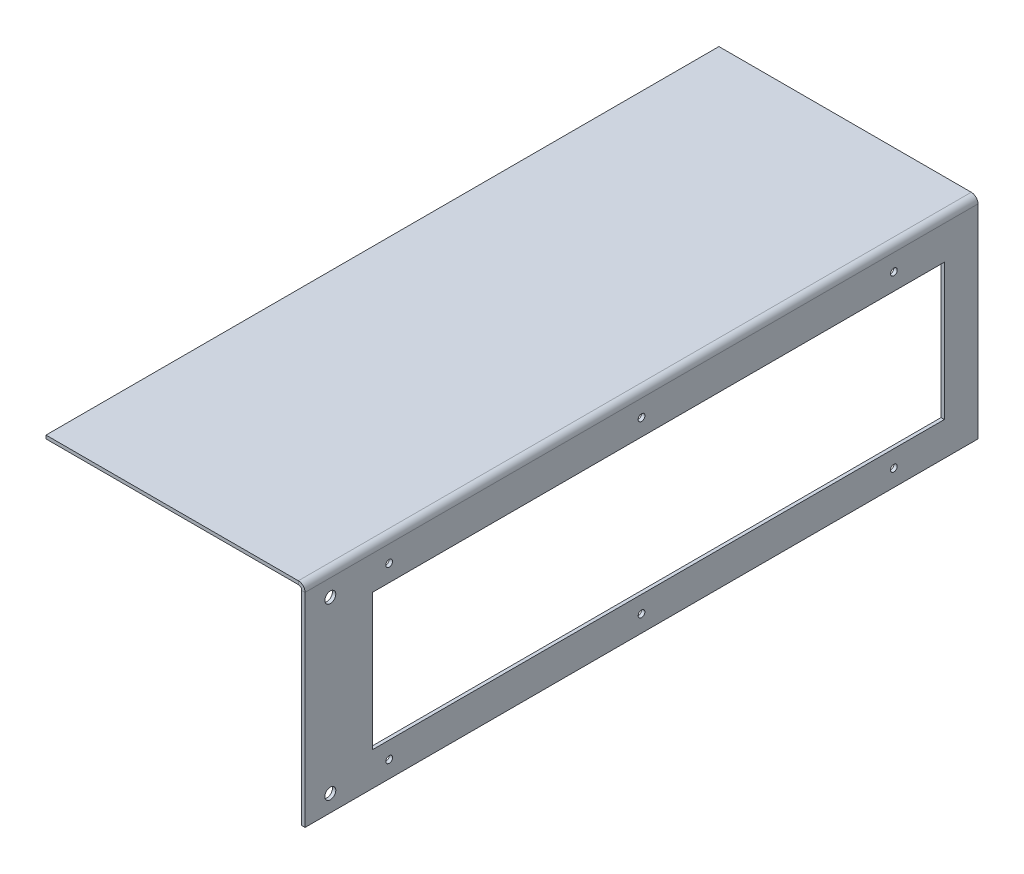
from build123d import *

# Parameters (mm, degrees)
BOSS_EXTRUDE1_DEPTH  = 400
CUT_EXTRUDE1_REACH   = 448.476
SKETCH2_W            = 340
SKETCH2_H            = 81
CUT_EXTRUDE2_REACH   = 448.476
SKETCH4_R            = 3.25
SKETCH5_R            = 2
CUT_EXTRUDE3_DEPTH   = 10
CONVERT_SOLID1_DEPTH = 400


# Read off the part's stored shape, not the designer's step: Convert-Solid1
with BuildPart() as part:
    # Sketch1 → Boss-Extrude1 (new body)
    with BuildSketch(Plane.XY):
        with BuildLine():
            Line((-75, 0), (75, 0))
            ThreePointArc((75, 0), (77.828427125, -1.171572875), (79, -4))
            Line((79, -4), (79, -125))
            Line((79, -125), (77, -125))
            Line((77, -125), (77, -6))
            ThreePointArc((77, -6), (75.828427125, -3.171572875), (73, -2))
            Line((73, -2), (-75, -2))
            Line((-75, -2), (-75, 0))
        make_face()
    extrude(amount=BOSS_EXTRUDE1_DEPTH)

    # Sketch2 → Cut-Extrude1 (cut, up to next)
    with BuildSketch(Plane(origin=(79, 0, 0), x_dir=(0, 0, -1), z_dir=(1, 0, 0)), mode=Mode.PRIVATE) as cut_extrude1_sk1:
        with Locations((-190, -64.5)):
            Rectangle(SKETCH2_W, SKETCH2_H)
    cut_extrude1_tool1 = extrude(cut_extrude1_sk1.sketch, amount=-CUT_EXTRUDE1_REACH, mode=Mode.PRIVATE) & part.part
    add(cut_extrude1_tool1.solids().sort_by_distance((79, -64.5, 190))[0], mode=Mode.SUBTRACT)

    # Sketch4 → Cut-Extrude2 (cut, up to next)
    with BuildSketch(Plane(origin=(79, 0, 0), x_dir=(0, 0, -1), z_dir=(1, 0, 0)), mode=Mode.PRIVATE) as cut_extrude2_sk1:
        with Locations(Location((-385, -14, 0), (0, 0, 90))):
            Circle(SKETCH4_R)
    cut_extrude2_tool1 = extrude(cut_extrude2_sk1.sketch, amount=-CUT_EXTRUDE2_REACH, mode=Mode.PRIVATE) & part.part
    # Sketch4 → Cut-Extrude2 (cut, up to next)
    with BuildSketch(Plane(origin=(79, 0, 0), x_dir=(0, 0, -1), z_dir=(1, 0, 0)), mode=Mode.PRIVATE) as cut_extrude2_sk2:
        with Locations(Location((-385, -115, 0), (0, 0, 90))):
            Circle(SKETCH4_R)
    cut_extrude2_tool2 = extrude(cut_extrude2_sk2.sketch, amount=-CUT_EXTRUDE2_REACH, mode=Mode.PRIVATE) & part.part
    add(cut_extrude2_tool1.solids().sort_by_distance((79, -14, 385))[0], mode=Mode.SUBTRACT)
    add(cut_extrude2_tool2.solids().sort_by_distance((79, -115, 385))[0], mode=Mode.SUBTRACT)

    # Sketch5 → Cut-Extrude3 (cut)
    with BuildSketch(Plane(origin=(79, 0, 0), x_dir=(0, 0, -1), z_dir=(1, 0, 0))):
        with Locations(Location((-50, -115, 0), (0, 0, 90))):
            Circle(SKETCH5_R)
        with Locations(Location((-200, -115, 0), (0, 0, 90))):
            Circle(SKETCH5_R)
        with Locations(Location((-350, -115, 0), (0, 0, 90))):
            Circle(SKETCH5_R)
        with Locations(Location((-350, -14, 0), (0, 0, 90))):
            Circle(SKETCH5_R)
        with Locations(Location((-200, -14, 0), (0, 0, 90))):
            Circle(SKETCH5_R)
        with Locations(Location((-50, -14, 0), (0, 0, 90))):
            Circle(SKETCH5_R)
    extrude(amount=-CUT_EXTRUDE3_DEPTH, mode=Mode.SUBTRACT)

    # Convert-Solid1 outline → Convert-Solid1 (cut)
    with BuildSketch(Plane.XY):
        with BuildLine():
            ThreePointArc((77, -4), (76.414213562, -2.585786438), (75, -2))
            Line((75, -2), (73, -2))
            ThreePointArc((73, -2), (75.828427125, -3.171572875), (77, -6))
            Line((77, -6), (77, -4))
        make_face()
    extrude(amount=CONVERT_SOLID1_DEPTH, mode=Mode.SUBTRACT)


solid = part.part
